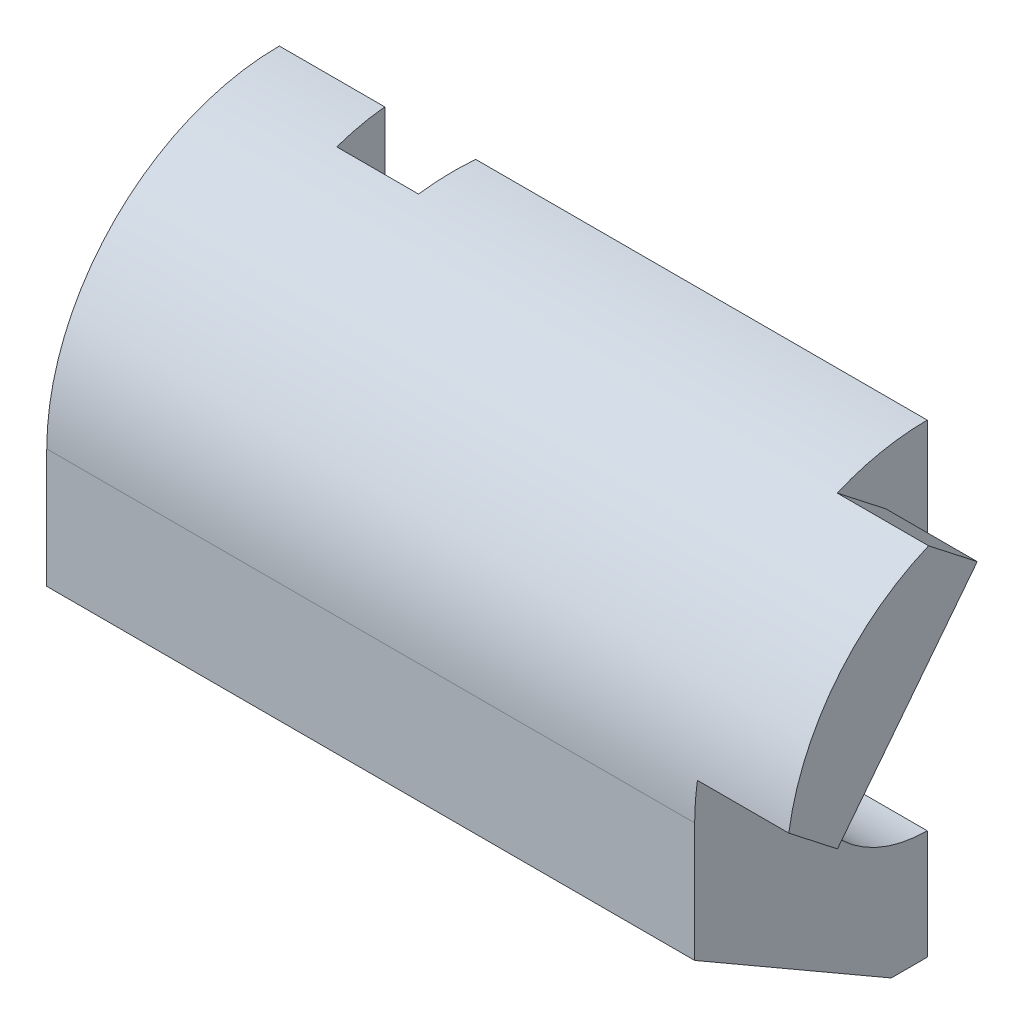
from build123d import *

# Parameters (mm, degrees)
BOSS_EXTRUDE1_DEPTH = 234
CUT_EXTRUDE1_DEPTH  = 78
BOSS_EXTRUDE2_DEPTH = 33
CUT_EXTRUDE2_DEPTH  = 13
SKETCH6_W           = 33
SKETCH6_H           = 84.469943203
CUT_EXTRUDE3_DEPTH  = 19
CHAMFER2_SIZE       = 1.749773271
CHAMFER2_SIZE_2     = 20


with BuildPart() as part:
    # Sketch1 → Boss-Extrude1 (new body)
    with BuildSketch(Plane(origin=(0, 0, 0), x_dir=(0, 0, -1), z_dir=(1, 0, 0))):
        with BuildLine():
            Line((0, 0), (-13, 0))
            Line((-13, 0), (-84, 40.991869112))
            Line((-84, 40.991869112), (-84, 84))
            ThreePointArc((-84, 84), (-59.39696962, 143.39696962), (0, 168))
            Line((0, 168), (0, 112.575))
            ThreePointArc((0, 112.575), (-28.575, 84), (0, 55.425))
            Line((0, 55.425), (0, 0))
        make_face()
    extrude(amount=BOSS_EXTRUDE1_DEPTH)

    # Sketch2 → Cut-Extrude1 (cut)
    with BuildSketch(Plane(origin=(234, 0, 0), x_dir=(0, 0, -1), z_dir=(1, 0, 0))):
        with BuildLine():
            Line((0, 128.45), (0, 39.55))
            ThreePointArc((0, 39.55), (-44.45, 84), (0, 128.45))
        make_face()
    extrude(amount=-CUT_EXTRUDE1_DEPTH, mode=Mode.SUBTRACT)

    # Sketch3 → Boss-Extrude2 (add)
    with BuildSketch(Plane(origin=(234, 0, 0), x_dir=(0, 0, -1), z_dir=(1, 0, 0))):
        with BuildLine():
            Line((-83.014649379, 96.828405531), (-65.430668922, 83.090294344))
            Line((-65.430668922, 83.090294344), (-14.946427946, 147.707176139))
            Line((-14.946427946, 147.707176139), (-32.530408402, 161.445287327))
            ThreePointArc((-32.530408402, 161.445287327), (-66.192903303, 135.715563927), (-83.014649379, 96.828405531))
        make_face()
    extrude(amount=BOSS_EXTRUDE2_DEPTH)

    # Sketch4 → Cut-Extrude2 (cut)
    with BuildSketch(Plane(origin=(0, 0, 0), x_dir=(-1, 0, 0), z_dir=(0, 0, -1))):
        with BuildLine():
            Line((0, 15), (-117, 15))
            ThreePointArc((-117, 15), (-128, 26), (-117, 37))
            Line((-117, 37), (0, 37))
            ThreePointArc((0, 37), (11, 26), (0, 15))
        make_face()
    extrude(amount=-CUT_EXTRUDE2_DEPTH, mode=Mode.SUBTRACT)

    # Sketch6 → Cut-Extrude3 (cut)
    with BuildSketch(Plane(origin=(0, 0, 0), x_dir=(-1, 0, 0), z_dir=(0, 0, -1))):
        with Locations((-54.5, 125.765028398)):
            Rectangle(SKETCH6_W, SKETCH6_H)
    extrude(amount=-CUT_EXTRUDE3_DEPTH, mode=Mode.SUBTRACT)

    # Chamfer2
    # the kernel refuses this chamfer: 20, 1.749773271 mm, written as the material it adds along each edge
    with BuildSketch(Plane(origin=(38, 53.350481829, 19), x_dir=(0.9159861691531124, 0, 0.4012098427509048), z_dir=(0, 1, 0))) as chamfer2_piece_1_section:
        Polygon((CHAMFER2_SIZE * 0.915986168901, CHAMFER2_SIZE * 0.40120984264), (-CHAMFER2_SIZE_2 * 0.401209842751, CHAMFER2_SIZE_2 * 0.915986169153), (0, 0), align=None)
    chamfer2_piece_1 = extrude(amount=164.465179425, mode=Mode.PRIVATE)
    chamfer2_piece_1 = chamfer2_piece_1 - Plane(origin=(38.476894186, 84, 0), x_dir=(0, 1, 0), z_dir=(-1, 0, 0)) * Cylinder(28.575, 403, mode=Mode.PRIVATE)
    chamfer2_piece_1 = split(chamfer2_piece_1, bisect_by=Plane(origin=(38.476894186, 56.471998141, 0), z_dir=(0, 0, 1)), keep=Keep.TOP, mode=Mode.PRIVATE)
    chamfer2_piece_1 = chamfer2_piece_1 & Plane(origin=(38.476894186, 84, 0), x_dir=(0, 0, 1), z_dir=(-1, 0, 0)) * Cylinder(84, 403, mode=Mode.PRIVATE)
    add(chamfer2_piece_1)
    with BuildSketch(Plane(origin=(71, 217.815661254, 19), x_dir=(0.003352615794032912, 0, -0.9999943799678763), z_dir=(0, -1, 0))) as chamfer2_piece_2_section:
        Polygon((CHAMFER2_SIZE_2 * 0.999994379968, -CHAMFER2_SIZE_2 * 0.00335261579403), (-CHAMFER2_SIZE * 0.00335261579311, -CHAMFER2_SIZE * 0.999994379693), (0, 0), align=None)
    chamfer2_piece_2 = extrude(amount=164.465179425, mode=Mode.PRIVATE)
    chamfer2_piece_2 = chamfer2_piece_2 - Plane(origin=(70.625797468, 84, 0), x_dir=(0, 1, 0), z_dir=(-1, 0, 0)) * Cylinder(28.575, 409, mode=Mode.PRIVATE)
    chamfer2_piece_2 = chamfer2_piece_2 & Plane(origin=(70.625797468, 84, 0), x_dir=(0, 0, 1), z_dir=(-1, 0, 0)) * Cylinder(84, 409, mode=Mode.PRIVATE)
    chamfer2_piece_2 = split(chamfer2_piece_2, bisect_by=Plane(origin=(70.625797468, 138.170488536, 0), z_dir=(0, 0, 1)), keep=Keep.TOP, mode=Mode.PRIVATE)
    add(chamfer2_piece_2)


solid = part.part
